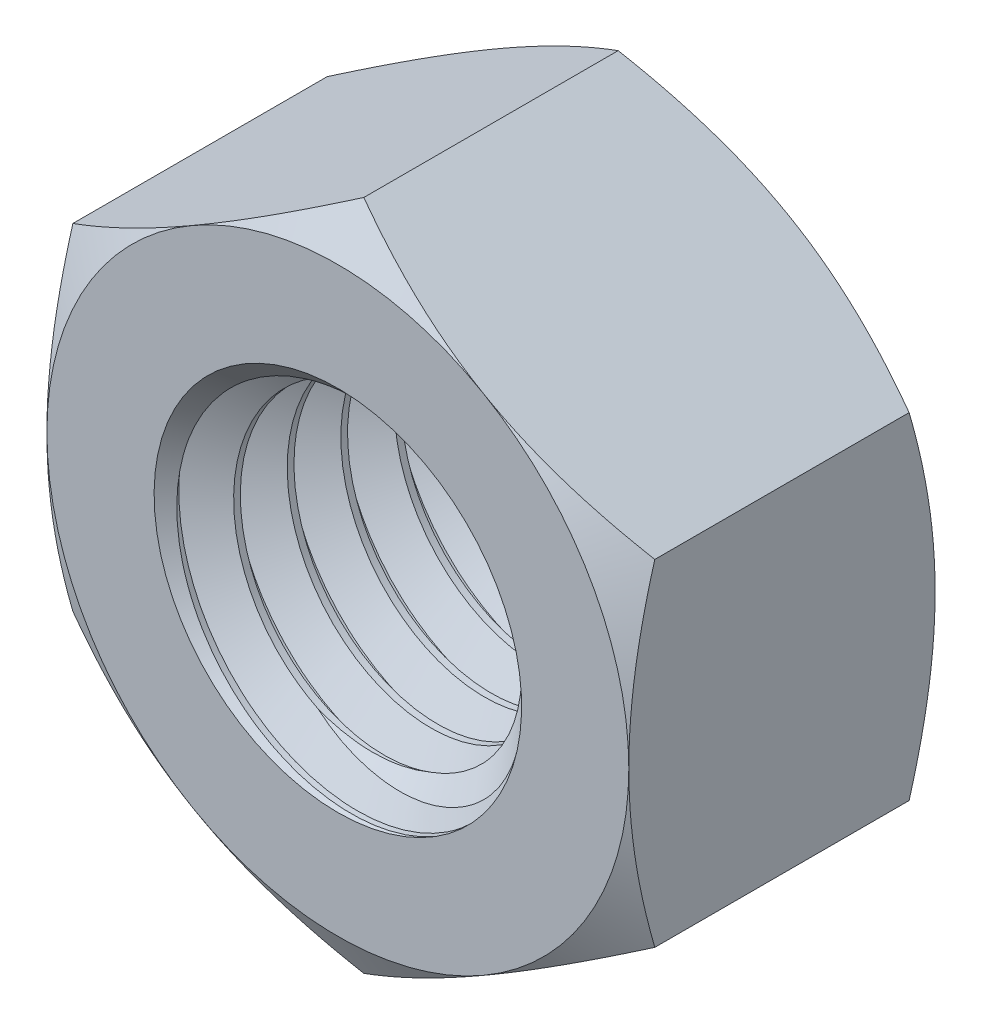
from build123d import *

# Parameters (mm, degrees)
EXTRUDE1_DEPTH          = 5
SKETCH13_R              = 6
BOSS_EXTRUDE1_DEPTH     = 10
CUT_SWEEP1_PITCH        = 1.75
SKETCH7_OUTSIDE_W       = 115.128
SKETCH7_OUTSIDE_H       = 118.068
SKETCH7_OUTSIDE_R       = 9.5
EXTRUDE2_DEPTH          = 25.4
EXTRUDE2_DRAFT          = -60
MIRROR2_COPY_1_SKETCH_W = 115.128
MIRROR2_COPY_1_SKETCH_H = 118.068
MIRROR2_COPY_1_SKETCH_R = 9.5
MIRROR2_COPY_1_DEPTH    = 25.4
MIRROR2_COPY_1_DRAFT    = -60


with BuildPart() as part:
    # Sketch1 → Extrude1 (new, symmetric)
    with BuildSketch(Plane.XY):
        Polygon((-9.5, 5.484827557), (-9.5, -5.484827557), (0, -10.969655115), (9.5, -5.484827557), (9.5, 5.484827557), (0, 10.969655115), align=None)
    extrude(amount=EXTRUDE1_DEPTH, both=True)

    # Cut-Extrude2 cone 1 section (through the dimple's axis) → Cut-Extrude2 (revolve, cut)
    with BuildSketch(Plane(origin=(0, 0, 5), x_dir=(0, -1, 0), z_dir=(1, 0, 0))):
        Polygon((0, 0), (6, 0), (0, 6), align=None)
    revolve(axis=Axis((0, 0, 5), (0, 0, -1)), mode=Mode.SUBTRACT)

    # Cut-Extrude3 cone 1 section (through the dimple's axis) → Cut-Extrude3 (revolve, cut)
    with BuildSketch(Plane(origin=(0, 0, -5), x_dir=(0, 1, 0), z_dir=(1, 0, 0))):
        Polygon((0, 0), (6, 0), (0, 6), align=None)
    revolve(axis=Axis((0, 0, -5), (0, 0, 1)), mode=Mode.SUBTRACT)


with BuildPart() as body_2:
    # Sketch13 → Boss-Extrude1 (new body)
    with BuildSketch(Plane(origin=(0, 0, -5), x_dir=(-1, 0, 0), z_dir=(0, 0, -1))):
        Circle(SKETCH13_R)
    extrude(amount=-BOSS_EXTRUDE1_DEPTH)

    # Cut-Sweep1: arcs per turn and ends read off the stored shape
    # Cut-Sweep1: the profile of Sketch12 profile screwed along a right-hand helix through 7.6 turns, 10 arcs to a turn; built about Z, then put on its axis
    cut_sweep1_z = Axis((0, 0, 0), (0, 0, 1))
    cut_sweep1_corners = [(6.0003, 0, -3.281423205), (6.0003, 0, -1.749826795), (4.863341658, 0, -2.40625), (4.863341658, 0, -2.625)]
    with BuildLine(mode=Mode.PRIVATE) as cut_sweep1_profile:
        Line(cut_sweep1_corners[0], cut_sweep1_corners[1])
        Line(cut_sweep1_corners[1], cut_sweep1_corners[2])
        Line(cut_sweep1_corners[2], cut_sweep1_corners[3])
        Line(cut_sweep1_corners[3], cut_sweep1_corners[0])
    cut_sweep1_cap = Face(cut_sweep1_profile.wire())
    cut_sweep1_turn_angles = [0, 18, 36, 54, 72, 90, 108, 126, 144, 162, 180, 198, 216, 234, 252, 270, 288, 306, 324, 342, 360]
    cut_sweep1_turn_weights = [1, 0.9510565162951535, 1, 0.9510565162951535, 1, 0.9510565162951535, 1, 0.9510565162951535, 1, 0.9510565162951535, 1, 0.9510565162951535, 1, 0.9510565162951535, 1, 0.9510565162951535, 1, 0.9510565162951535, 1, 0.9510565162951535, 1]
    cut_sweep1_turn_rails = [Edge.make_bspline([Vector(p[0], p[1], 0).rotate(cut_sweep1_z, cut_sweep1_turn_angles[k]) / cut_sweep1_turn_weights[k] + Vector(0, 0, p[2] + CUT_SWEEP1_PITCH * cut_sweep1_turn_angles[k] / 360) for k in range(21)], [0, 0, 0, 1, 1, 2, 2, 3, 3, 4, 4, 5, 5, 6, 6, 7, 7, 8, 8, 9, 9, 10, 10, 10], 2, cut_sweep1_turn_weights) for p in cut_sweep1_corners]
    cut_sweep1_turn_sides = [Face.make_surface_from_curves(cut_sweep1_turn_rails[p[0]], cut_sweep1_turn_rails[p[1]]) for p in [(0, 1), (1, 2), (2, 3), (3, 0)]]
    cut_sweep1_last_angles = [2520, 2538, 2556, 2574, 2592, 2610, 2628, 2646, 2664, 2682, 2700, 2718, 2736]
    cut_sweep1_last_weights = [1, 0.9510565162951535, 1, 0.9510565162951535, 1, 0.9510565162951535, 1, 0.9510565162951535, 1, 0.9510565162951535, 1, 0.9510565162951535, 1]
    cut_sweep1_last_rails = [Edge.make_bspline([Vector(p[0], p[1], 0).rotate(cut_sweep1_z, cut_sweep1_last_angles[k]) / cut_sweep1_last_weights[k] + Vector(0, 0, p[2] + CUT_SWEEP1_PITCH * cut_sweep1_last_angles[k] / 360) for k in range(13)], [0, 0, 0, 1, 1, 2, 2, 3, 3, 4, 4, 5, 5, 6, 6, 6], 2, cut_sweep1_last_weights) for p in cut_sweep1_corners]
    cut_sweep1_last_sides = [Face.make_surface_from_curves(cut_sweep1_last_rails[p[0]], cut_sweep1_last_rails[p[1]]) for p in [(0, 1), (1, 2), (2, 3), (3, 0)]]
    cut_sweep1 = Plane(origin=(0, 0, -5), x_dir=(0, 1, 0), z_dir=(0, 0, 1)) * Solid(Shell([*[p.moved(Location((0, 0, CUT_SWEEP1_PITCH * i))) for i in range(7) for p in cut_sweep1_turn_sides], *cut_sweep1_last_sides, cut_sweep1_cap, cut_sweep1_cap.rotate(cut_sweep1_z, 2736).moved(Location((0, 0, CUT_SWEEP1_PITCH * 2736 / 360)))]))
    add(cut_sweep1, mode=Mode.SUBTRACT)


with BuildPart() as part_1:
    add(part.part)

    # Combine1: cut body 2
    add(body_2.part, mode=Mode.SUBTRACT)


with BuildPart() as extrude2_tool:
    # Sketch7 outside → Extrude2 (with draft: the straight prism first)
    with BuildSketch(Plane.XY.offset(5)):
        Rectangle(SKETCH7_OUTSIDE_W, SKETCH7_OUTSIDE_H)
        Circle(SKETCH7_OUTSIDE_R, mode=Mode.SUBTRACT)
    extrude(amount=-EXTRUDE2_DEPTH)
    # Extrude2: the draft: its side faces are tilted about the plane it starts from
    extrude2_sides = [extrude2_tool.faces().sort_by_distance(p)[0] for p in [
        (0, -59.034, -7.7),
        (57.564, 0, -7.7),
        (0, 59.034, -7.7),
        (-57.564, 0, -7.7),
        (-9.5, 0, -7.7),
    ]]
    draft(extrude2_sides, Plane.XY.offset(5), EXTRUDE2_DRAFT)


with BuildPart() as part_2:
    add(part_1.part)

    # Extrude2: cut by extrude2_tool
    add(extrude2_tool.part, mode=Mode.SUBTRACT)


with BuildPart() as mirror2_copy_1_tool:
    # Mirror2 copy 1 sketch → Mirror2 copy 1 (with draft: the straight prism first)
    with BuildSketch(Plane(origin=(0, 0, -5), x_dir=(1, 0, 0), z_dir=(0, 0, -1))):
        Rectangle(MIRROR2_COPY_1_SKETCH_W, MIRROR2_COPY_1_SKETCH_H)
        Circle(MIRROR2_COPY_1_SKETCH_R, mode=Mode.SUBTRACT)
    extrude(amount=-MIRROR2_COPY_1_DEPTH)
    # Mirror2 copy 1: the draft: its side faces are tilted about the plane it starts from
    mirror2_copy_1_sides = [mirror2_copy_1_tool.faces().sort_by_distance(p)[0] for p in [
        (0, -59.034, 7.7),
        (57.564, 0, 7.7),
        (0, 59.034, 7.7),
        (-57.564, 0, 7.7),
        (-9.5, 0, 7.7),
    ]]
    draft(mirror2_copy_1_sides, Plane(origin=(0, 0, -5), x_dir=(1, 0, 0), z_dir=(0, 0, -1)), MIRROR2_COPY_1_DRAFT)


with BuildPart() as part_3:
    add(part_2.part)

    # Mirror2 copy 1: cut by mirror2_copy_1_tool
    add(mirror2_copy_1_tool.part, mode=Mode.SUBTRACT)


solid = part_3.part
